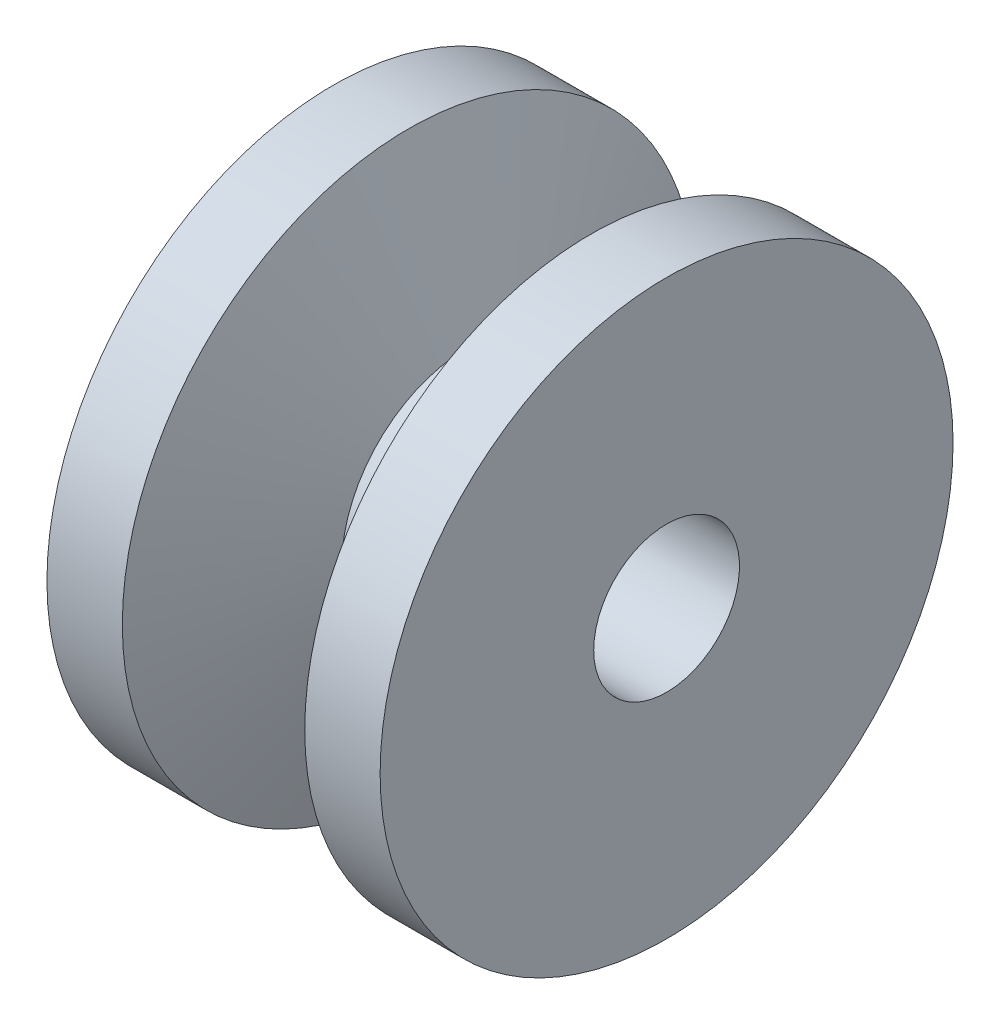
from build123d import *


with BuildPart() as part:
    # Sketch1 → Revolve1 (revolve)
    with BuildSketch(Plane(origin=(0, 0, 0), x_dir=(1, 0, 0), z_dir=(0, 1, 0))):
        Polygon((0, 14.478), (3.81, 14.478), (6.768350064, 6.35), (10.070350064, 6.35), (13.028700128, 14.478), (16.838700128, 14.478), (16.838700128, 3.683), (0, 3.683), align=None)
    revolve(axis=Axis((0, 0, 0), (1, 0, 0)))


solid = part.part
